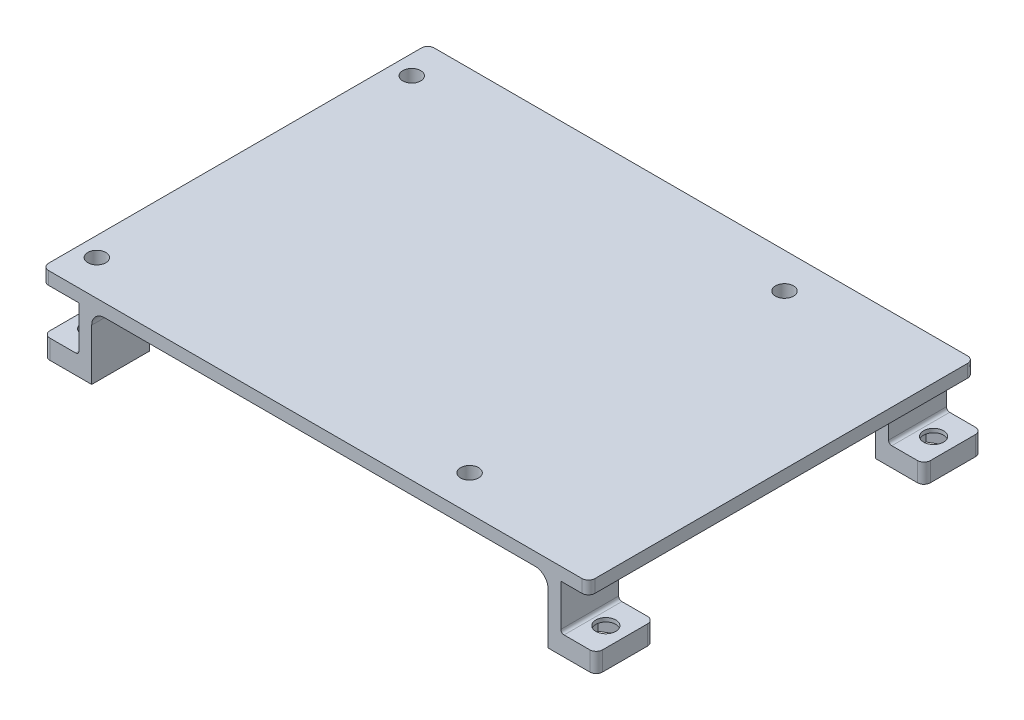
from build123d import *

# Parameters (mm, degrees)
EXTRUDE_1_DEPTH          = 30
CUT_EXTRUDE_1_DEPTH      = 54.946640303
CUT_EXTRUDE_1_DEPTH_BACK = 54.946640303
SKETCH_2_W               = 42
SKETCH_2_H               = 12
CUT_EXTRUDE_4_REACH      = 55.947
SKETCH_3_R               = 1.55
SKETCH_5_R               = 1.4
CUT_EXTRUDE_5_DEPTH      = 5
CUT_EXTRUDE_7_DEPTH      = 2.4
FILLET_1_R               = 1
FILLET_5_R               = 0.5
FILLET_7_R               = 2


with BuildPart() as part:
    # 草圖1 → 填料-伸長1 (new, symmetric)
    with BuildSketch(Plane.XY):
        Polygon((-43, 0), (-43, 3), (-37.5, 3), (-37.5, 10), (-43.2, 10), (-43.2, 12), (41.8, 12), (41.8, 10), (37.5, 10), (37.5, 3), (43, 3), (43, 0), (35.5, 0), (35.5, 10), (-35.5, 10), (-35.5, 0), align=None)
    extrude(amount=EXTRUDE_1_DEPTH, both=True)

    # 草圖2 → 除料-伸長1 (cut, two sides: drawn at the far end of the back side and taken through both)
    with BuildSketch(Plane(origin=(0, 0, 0), x_dir=(0, 0, -1), z_dir=(1, 0, 0)).offset(-CUT_EXTRUDE_1_DEPTH_BACK)):
        Rectangle(SKETCH_2_W, SKETCH_2_H)
    extrude(amount=CUT_EXTRUDE_1_DEPTH + CUT_EXTRUDE_1_DEPTH_BACK, mode=Mode.SUBTRACT)

    # 草圖3 → 除料-伸長4 (cut, up to next)
    with BuildSketch(Plane(origin=(0, 0, 0), x_dir=(1, 0, 0), z_dir=(0, 1, 0)), mode=Mode.PRIVATE) as cut_extrude_4_sk1:
        with Locations((-40, 25.5)):
            Circle(SKETCH_3_R)
    cut_extrude_4_tool1 = extrude(cut_extrude_4_sk1.sketch, amount=CUT_EXTRUDE_4_REACH, mode=Mode.PRIVATE) & part.part
    # 草圖3 → 除料-伸長4 (cut, up to next)
    with BuildSketch(Plane(origin=(0, 0, 0), x_dir=(1, 0, 0), z_dir=(0, 1, 0)), mode=Mode.PRIVATE) as cut_extrude_4_sk2:
        with Locations((40, 25.5)):
            Circle(SKETCH_3_R)
    cut_extrude_4_tool2 = extrude(cut_extrude_4_sk2.sketch, amount=CUT_EXTRUDE_4_REACH, mode=Mode.PRIVATE) & part.part
    # 草圖3 → 除料-伸長4 (cut, up to next)
    with BuildSketch(Plane(origin=(0, 0, 0), x_dir=(1, 0, 0), z_dir=(0, 1, 0)), mode=Mode.PRIVATE) as cut_extrude_4_sk3:
        with Locations((40, -25.5)):
            Circle(SKETCH_3_R)
    cut_extrude_4_tool3 = extrude(cut_extrude_4_sk3.sketch, amount=CUT_EXTRUDE_4_REACH, mode=Mode.PRIVATE) & part.part
    # 草圖3 → 除料-伸長4 (cut, up to next)
    with BuildSketch(Plane(origin=(0, 0, 0), x_dir=(1, 0, 0), z_dir=(0, 1, 0)), mode=Mode.PRIVATE) as cut_extrude_4_sk4:
        with Locations((-40, -25.5)):
            Circle(SKETCH_3_R)
    cut_extrude_4_tool4 = extrude(cut_extrude_4_sk4.sketch, amount=CUT_EXTRUDE_4_REACH, mode=Mode.PRIVATE) & part.part
    add(cut_extrude_4_tool1.solids().sort_by_distance((-40, 0, -25.5))[0], mode=Mode.SUBTRACT)
    add(cut_extrude_4_tool2.solids().sort_by_distance((40, 0, -25.5))[0], mode=Mode.SUBTRACT)
    add(cut_extrude_4_tool3.solids().sort_by_distance((40, 0, 25.5))[0], mode=Mode.SUBTRACT)
    add(cut_extrude_4_tool4.solids().sort_by_distance((-40, 0, 25.5))[0], mode=Mode.SUBTRACT)

    # 草圖5 → 除料-伸長5 (cut)
    with BuildSketch(Plane(origin=(0, 12, 0), x_dir=(1, 0, 0), z_dir=(0, 1, 0))):
        with Locations((-40.2, 24.5)):
            Circle(SKETCH_5_R)
        with Locations((-40.2, -24.5)):
            Circle(SKETCH_5_R)
        with Locations((17.8, 24.5)):
            Circle(SKETCH_5_R)
        with Locations((17.8, -24.5)):
            Circle(SKETCH_5_R)
    extrude(amount=-CUT_EXTRUDE_5_DEPTH, mode=Mode.SUBTRACT)

    # 草圖16 → 除料-伸長7 (cut)
    with BuildSketch(Plane.XZ):
        Polygon((-40, 22.209103466), (-37.15, 23.854551733), (-37.15, 27.145448267), (-40, 28.790896534), (-42.85, 27.145448267), (-42.85, 23.854551733), align=None)
        Polygon((-42.85, -23.854551733), (-40, -22.209103466), (-37.15, -23.854551733), (-37.15, -27.145448267), (-40, -28.790896534), (-42.85, -27.145448267), align=None)
        Polygon((40, -22.209103466), (37.15, -23.854551733), (37.15, -27.145448267), (40, -28.790896534), (42.85, -27.145448267), (42.85, -23.854551733), align=None)
        Polygon((42.85, 23.854551733), (40, 22.209103466), (37.15, 23.854551733), (37.15, 27.145448267), (40, 28.790896534), (42.85, 27.145448267), align=None)
    extrude(amount=-CUT_EXTRUDE_7_DEPTH, mode=Mode.SUBTRACT)

    # 圓角1
    fillet_1_edges = [part.edges().sort_by_distance(p)[0] for p in [
        (41.8, 11, -30),
        (43, 1.5, -30),
        (43, 1.5, -21),
        (43, 1.5, 21),
        (43, 1.5, 30),
        (41.8, 11, 30),
        (-43.2, 11, -30),
        (-43, 1.5, -30),
        (-43, 1.5, -21),
        (-43, 1.5, 21),
        (-43, 1.5, 30),
        (-43.2, 11, 30),
    ]]
    fillet(fillet_1_edges, radius=FILLET_1_R)

    # 圓角5
    fillet_5_edges = [part.edges().sort_by_distance(p)[0] for p in [
        (37.5, 3, -25.5),
        (37.5, 3, 25.5),
        (-37.5, 3, -25.5),
        (-37.5, 3, 25.5),
    ]]
    fillet(fillet_5_edges, radius=FILLET_5_R)

    # 圓角7
    fillet_7_edges = [part.edges().sort_by_distance(p)[0] for p in [
        (35.5, 10, 0),
        (-35.5, 10, 0),
    ]]
    fillet(fillet_7_edges, radius=FILLET_7_R)


solid = part.part
